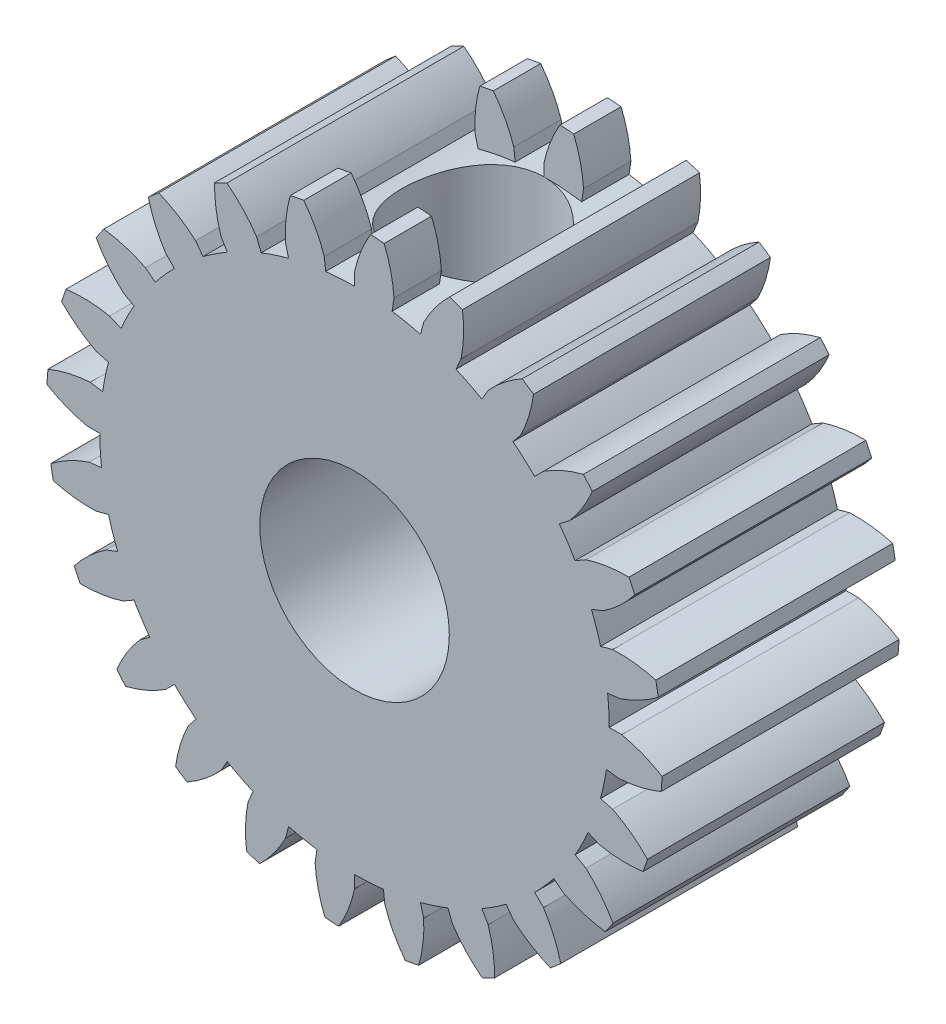
from build123d import *
from build123d.topology import SkipClean

# Parameters (mm, degrees)
BOSS_EXTRUDE1_DEPTH     = 5
CIRPATTERN1_COUNT       = 24
SKETCH6_R               = 5.375
SKETCH6_R_2             = 2
BOSS_EXTRUDE3_DEPTH     = 5
CUT_EXTRUDE1_REACH      = 12.453
CUT_EXTRUDE1_END_RADIUS = 6.5
SKETCH7_R               = 1.5
CUT_EXTRUDE2_REACH      = 22.453
CUT_EXTRUDE2_END_RADIUS = 5.375
CUT_EXTRUDE2_START      = 10
SKETCH8_W               = 3
SKETCH8_H               = 3


with BuildPart() as part:
    # Sketch3 → Boss-Extrude1 (new body)
    with BuildSketch(Plane.XY):
        with BuildLine():
            Line((0.832115143, 5.576413217), (0.793276935, 5.316139267))
            ThreePointArc((0.793276935, 5.316139267), (0.397728828, 5.360264618), (0, 5.375))
            Line((0, 5.375), (0, 5.638155725))
            ThreePointArc((0, 5.638155725), (0.133339056, 6.078544815), (0.336758029, 6.491270602))
            ThreePointArc((0.336758029, 6.491270602), (0.480974396, 6.482180469), (0.624953054, 6.469886682))
            ThreePointArc((0.624953054, 6.469886682), (0.765231704, 6.031658711), (0.832115143, 5.576413217))
        make_face()
    extrude(amount=BOSS_EXTRUDE1_DEPTH)


with BuildPart() as cirpattern1_1:
    # CirPattern1: pattern copy
    add(part.part.rotate(Axis((0, 0, 0), (0, 0, 1)), 1 * 360 / CIRPATTERN1_COUNT))


with BuildPart() as cirpattern1_2:
    # CirPattern1: pattern copy
    add(part.part.rotate(Axis((0, 0, 0), (0, 0, 1)), 2 * 360 / CIRPATTERN1_COUNT))


with BuildPart() as cirpattern1_3:
    # CirPattern1: pattern copy
    add(part.part.rotate(Axis((0, 0, 0), (0, 0, 1)), 3 * 360 / CIRPATTERN1_COUNT))


with BuildPart() as cirpattern1_4:
    # CirPattern1: pattern copy
    add(part.part.rotate(Axis((0, 0, 0), (0, 0, 1)), 4 * 360 / CIRPATTERN1_COUNT))


with BuildPart() as cirpattern1_5:
    # CirPattern1: pattern copy
    add(part.part.rotate(Axis((0, 0, 0), (0, 0, 1)), 5 * 360 / CIRPATTERN1_COUNT))


with BuildPart() as cirpattern1_6:
    # CirPattern1: pattern copy
    add(part.part.rotate(Axis((0, 0, 0), (0, 0, 1)), 6 * 360 / CIRPATTERN1_COUNT))


with BuildPart() as cirpattern1_7:
    # CirPattern1: pattern copy
    add(part.part.rotate(Axis((0, 0, 0), (0, 0, 1)), 7 * 360 / CIRPATTERN1_COUNT))


with BuildPart() as cirpattern1_8:
    # CirPattern1: pattern copy
    add(part.part.rotate(Axis((0, 0, 0), (0, 0, 1)), 8 * 360 / CIRPATTERN1_COUNT))


with BuildPart() as cirpattern1_9:
    # CirPattern1: pattern copy
    add(part.part.rotate(Axis((0, 0, 0), (0, 0, 1)), 9 * 360 / CIRPATTERN1_COUNT))


with BuildPart() as cirpattern1_10:
    # CirPattern1: pattern copy
    add(part.part.rotate(Axis((0, 0, 0), (0, 0, 1)), 10 * 360 / CIRPATTERN1_COUNT))


with BuildPart() as cirpattern1_11:
    # CirPattern1: pattern copy
    add(part.part.rotate(Axis((0, 0, 0), (0, 0, 1)), 11 * 360 / CIRPATTERN1_COUNT))


with BuildPart() as cirpattern1_12:
    # CirPattern1: pattern copy
    add(part.part.rotate(Axis((0, 0, 0), (0, 0, 1)), 12 * 360 / CIRPATTERN1_COUNT))


with BuildPart() as cirpattern1_13:
    # CirPattern1: pattern copy
    add(part.part.rotate(Axis((0, 0, 0), (0, 0, 1)), 13 * 360 / CIRPATTERN1_COUNT))


with BuildPart() as cirpattern1_14:
    # CirPattern1: pattern copy
    add(part.part.rotate(Axis((0, 0, 0), (0, 0, 1)), 14 * 360 / CIRPATTERN1_COUNT))


with BuildPart() as cirpattern1_15:
    # CirPattern1: pattern copy
    add(part.part.rotate(Axis((0, 0, 0), (0, 0, 1)), 15 * 360 / CIRPATTERN1_COUNT))


with BuildPart() as cirpattern1_16:
    # CirPattern1: pattern copy
    add(part.part.rotate(Axis((0, 0, 0), (0, 0, 1)), 16 * 360 / CIRPATTERN1_COUNT))


with BuildPart() as cirpattern1_17:
    # CirPattern1: pattern copy
    add(part.part.rotate(Axis((0, 0, 0), (0, 0, 1)), 17 * 360 / CIRPATTERN1_COUNT))


with BuildPart() as cirpattern1_18:
    # CirPattern1: pattern copy
    add(part.part.rotate(Axis((0, 0, 0), (0, 0, 1)), 18 * 360 / CIRPATTERN1_COUNT))


with BuildPart() as cirpattern1_19:
    # CirPattern1: pattern copy
    add(part.part.rotate(Axis((0, 0, 0), (0, 0, 1)), 19 * 360 / CIRPATTERN1_COUNT))


with BuildPart() as cirpattern1_20:
    # CirPattern1: pattern copy
    add(part.part.rotate(Axis((0, 0, 0), (0, 0, 1)), 20 * 360 / CIRPATTERN1_COUNT))


with BuildPart() as cirpattern1_21:
    # CirPattern1: pattern copy
    add(part.part.rotate(Axis((0, 0, 0), (0, 0, 1)), 21 * 360 / CIRPATTERN1_COUNT))


with BuildPart() as cirpattern1_22:
    # CirPattern1: pattern copy
    add(part.part.rotate(Axis((0, 0, 0), (0, 0, 1)), 22 * 360 / CIRPATTERN1_COUNT))


with BuildPart() as cirpattern1_23:
    # CirPattern1: pattern copy
    add(part.part.rotate(Axis((0, 0, 0), (0, 0, 1)), 23 * 360 / CIRPATTERN1_COUNT))


with BuildPart() as part_1:
    add(part.part)

    add(cirpattern1_1.part)  # Boss-Extrude3 merges CirPattern1_1

    add(cirpattern1_2.part)  # Boss-Extrude3 merges CirPattern1_2

    add(cirpattern1_3.part)  # Boss-Extrude3 merges CirPattern1_3

    add(cirpattern1_4.part)  # Boss-Extrude3 merges CirPattern1_4

    add(cirpattern1_5.part)  # Boss-Extrude3 merges CirPattern1_5

    add(cirpattern1_6.part)  # Boss-Extrude3 merges CirPattern1_6

    add(cirpattern1_7.part)  # Boss-Extrude3 merges CirPattern1_7

    add(cirpattern1_8.part)  # Boss-Extrude3 merges CirPattern1_8

    add(cirpattern1_9.part)  # Boss-Extrude3 merges CirPattern1_9

    add(cirpattern1_10.part)  # Boss-Extrude3 merges CirPattern1_10

    add(cirpattern1_11.part)  # Boss-Extrude3 merges CirPattern1_11

    add(cirpattern1_12.part)  # Boss-Extrude3 merges CirPattern1_12

    add(cirpattern1_13.part)  # Boss-Extrude3 merges CirPattern1_13

    add(cirpattern1_14.part)  # Boss-Extrude3 merges CirPattern1_14

    add(cirpattern1_15.part)  # Boss-Extrude3 merges CirPattern1_15

    add(cirpattern1_16.part)  # Boss-Extrude3 merges CirPattern1_16

    add(cirpattern1_17.part)  # Boss-Extrude3 merges CirPattern1_17

    add(cirpattern1_18.part)  # Boss-Extrude3 merges CirPattern1_18

    add(cirpattern1_19.part)  # Boss-Extrude3 merges CirPattern1_19

    add(cirpattern1_20.part)  # Boss-Extrude3 merges CirPattern1_20

    add(cirpattern1_21.part)  # Boss-Extrude3 merges CirPattern1_21

    add(cirpattern1_22.part)  # Boss-Extrude3 merges CirPattern1_22

    add(cirpattern1_23.part)  # Boss-Extrude3 merges CirPattern1_23
    # Sketch6 → Boss-Extrude3 (add)
    with BuildSketch(Plane.XY):
        Circle(SKETCH6_R)
        Circle(SKETCH6_R_2, mode=Mode.SUBTRACT)
    extrude(amount=BOSS_EXTRUDE3_DEPTH)

    # Cut-Extrude1: up to this cylinder (the profile starts inside it)
    cut_extrude1_end = Plane(origin=(0, 0, 2.5), z_dir=(0, 0, -1)) * Cylinder(CUT_EXTRUDE1_END_RADIUS, 38.906, mode=Mode.PRIVATE)
    # Sketch7 → Cut-Extrude1 (cut, up to the surface)
    with BuildSketch(Plane(origin=(0, 0, 0), x_dir=(1, 0, 0), z_dir=(0, 1, 0)), mode=Mode.PRIVATE) as cut_extrude1_sk1:
        with Locations(Location((0, -2.5, 0), (0, 0, 90))):
            Circle(SKETCH7_R)
    cut_extrude1_tool1 = extrude(cut_extrude1_sk1.sketch, amount=CUT_EXTRUDE1_REACH, mode=Mode.PRIVATE) & cut_extrude1_end
    add(cut_extrude1_tool1.solids().sort_by_distance((0, 0, 2.5))[0], mode=Mode.SUBTRACT)

    # Cut-Extrude2: up to this cylinder (the profile starts outside it)
    with SkipClean():  # the faces are left unmerged after this step: merging them gives an invalid solid
        cut_extrude2_end = Plane(origin=(0, 0, 2.5), z_dir=(0, 0, -1)) * Cylinder(CUT_EXTRUDE2_END_RADIUS, 56.656, mode=Mode.PRIVATE)
        # Sketch8 → Cut-Extrude2 (cut, up to the surface)
        with BuildSketch(Plane(origin=(0, 0, 0), x_dir=(1, 0, 0), z_dir=(0, 1, 0)).offset(CUT_EXTRUDE2_START), mode=Mode.PRIVATE) as cut_extrude2_sk1:
            with Locations((0, -2.5)):
                Rectangle(SKETCH8_W, SKETCH8_H)
        cut_extrude2_tool1 = extrude(cut_extrude2_sk1.sketch, amount=-CUT_EXTRUDE2_REACH, mode=Mode.PRIVATE) - cut_extrude2_end
        add(cut_extrude2_tool1.solids().sort_by_distance((0, 10, 2.5))[0], mode=Mode.SUBTRACT)
    add(part_1.part.scale(1), mode=Mode.REPLACE)  # the faces are merged on a copy


solid = part_1.part
